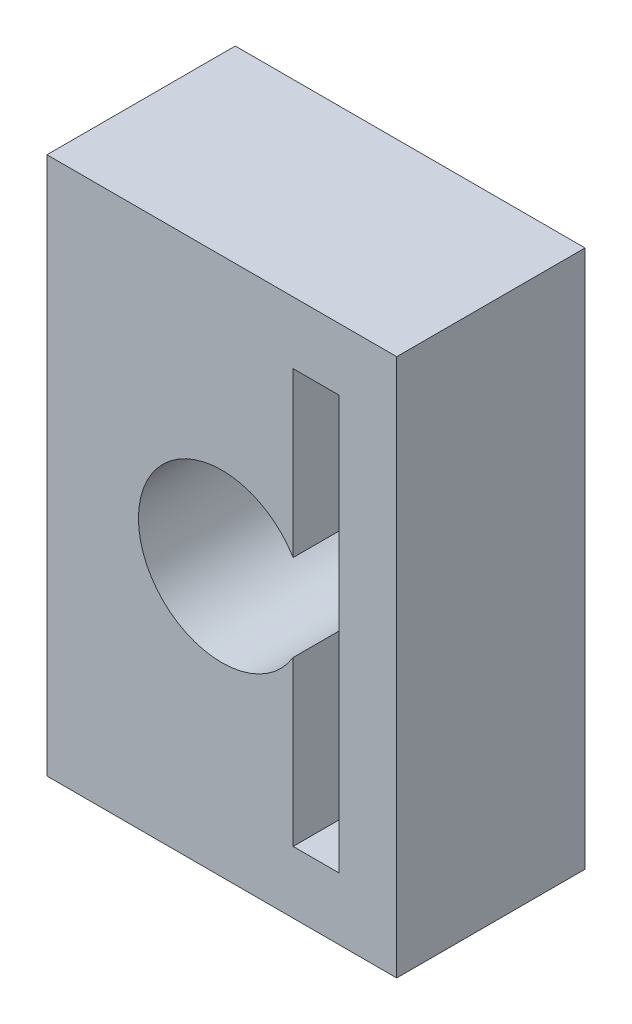
from build123d import *

# Parameters (mm, degrees)
SKETCH2_W           = 13
SKETCH2_H           = 20
BOSS_EXTRUDE1_DEPTH = 6
BOSS_EXTRUDE2_DEPTH = 2
BOSS_EXTRUDE3_START = 1
SKETCH3_W           = 13
SKETCH3_H           = 20
SKETCH3_R           = 3.2
BOSS_EXTRUDE3_DEPTH = 1
BOSS_EXTRUDE4_DEPTH = 4
CUT_EXTRUDE1_START  = -6
CUT_EXTRUDE1_DEPTH  = 6
BOSS_EXTRUDE5_DEPTH = 2
SKETCH8_R           = 3.2
SKETCH8_R_2         = 3.1
BOSS_EXTRUDE6_DEPTH = 7
SKETCH9_W           = 1.7
SKETCH9_H           = 15.38
CUT_EXTRUDE2_DEPTH  = 4


# Read off the part's stored shape, not the designer's step: Cut-Extrude1
with BuildPart() as part:
    # Sketch2 → Boss-Extrude1 (new body)
    with BuildSketch(Plane.XY):
        Rectangle(SKETCH2_W, SKETCH2_H)
        with BuildLine():
            Line((1.3, -9.04), (1.3, -2.924038303))
            ThreePointArc((1.3, -2.924038303), (-3.2, 0), (1.3, 2.924038303))
            Line((1.3, 2.924038303), (1.3, 9.04))
            Line((1.3, 9.04), (5.7, 9.04))
            Line((5.7, 9.04), (5.7, -9.04))
            Line((5.7, -9.04), (1.3, -9.04))
        make_face(mode=Mode.SUBTRACT)
    extrude(amount=BOSS_EXTRUDE1_DEPTH)

    # Sketch2<3> → Boss-Extrude2 (add)
    with BuildSketch(Plane.XY):
        with BuildLine():
            Line((4.2, 7.54), (4.2, -7.54))
            Line((4.2, -7.54), (2.8, -7.54))
            Line((2.8, -7.54), (2.8, -1.549193338))
            ThreePointArc((2.8, -1.549193338), (2.162186317, -2.359014695), (1.3, -2.924038303))
            Line((1.3, -2.924038303), (1.3, -9.04))
            Line((1.3, -9.04), (5.7, -9.04))
            Line((5.7, -9.04), (5.7, 9.04))
            Line((5.7, 9.04), (1.3, 9.04))
            Line((1.3, 9.04), (1.3, 2.924038303))
            ThreePointArc((1.3, 2.924038303), (2.162186317, 2.359014695), (2.8, 1.549193338))
            Line((2.8, 1.549193338), (2.8, 7.54))
            Line((2.8, 7.54), (4.2, 7.54))
        make_face()
    extrude(amount=BOSS_EXTRUDE2_DEPTH)

    # Sketch3 → Boss-Extrude3 (add)
    with BuildSketch(Plane(origin=(0, 0, 0), x_dir=(-1, 0, 0), z_dir=(0, 0, -1)).offset(BOSS_EXTRUDE3_START)):
        Rectangle(SKETCH3_W, SKETCH3_H)
        Circle(SKETCH3_R, mode=Mode.SUBTRACT)
    extrude(amount=-BOSS_EXTRUDE3_DEPTH)

    # Sketch4 → Boss-Extrude4 (add)
    with BuildSketch(Plane.XY.offset(2)):
        with BuildLine():
            Line((2.8, 1.549193338), (2.8, 7.54))
            Line((2.8, 7.54), (4.2, 7.54))
            Line((4.2, 7.54), (4.2, -7.54))
            Line((4.2, -7.54), (2.8, -7.54))
            Line((2.8, -7.54), (2.8, -1.549193338))
            ThreePointArc((2.8, -1.549193338), (2.162186317, -2.359014695), (1.3, -2.924038303))
            Line((1.3, -2.924038303), (1.3, -9.04))
            Line((1.3, -9.04), (5.7, -9.04))
            Line((5.7, -9.04), (5.7, 9.04))
            Line((5.7, 9.04), (1.3, 9.04))
            Line((1.3, 9.04), (1.3, 2.924038303))
            ThreePointArc((1.3, 2.924038303), (2.162186317, 2.359014695), (2.8, 1.549193338))
        make_face()
    extrude(amount=BOSS_EXTRUDE4_DEPTH)

    # Cut-Extrude1 outline → Cut-Extrude1 (cut)
    with BuildSketch(Plane.XY.offset(6).offset(CUT_EXTRUDE1_START)):
        with BuildLine():
            Line((4.35, 7.69), (2.65, 7.69))
            Line((2.65, 7.69), (2.65, 1.793739111))
            ThreePointArc((2.65, 1.793739111), (2.727741861, 1.673148033), (2.8, 1.549193338))
            Line((2.8, 1.549193338), (2.8, 7.54))
            Line((2.8, 7.54), (4.2, 7.54))
            Line((4.2, 7.54), (4.2, -7.54))
            Line((4.2, -7.54), (2.8, -7.54))
            Line((2.8, -7.54), (2.8, -1.549193338))
            ThreePointArc((2.8, -1.549193338), (2.727741861, -1.673148033), (2.65, -1.793739111))
            Line((2.65, -1.793739111), (2.65, -7.69))
            Line((2.65, -7.69), (4.35, -7.69))
            Line((4.35, -7.69), (4.35, 7.69))
        make_face()
    extrude(amount=CUT_EXTRUDE1_DEPTH, mode=Mode.SUBTRACT)

    # Sketch7 → Boss-Extrude5 (add)
    with BuildSketch(Plane.XY):
        with BuildLine():
            Line((2.65, 7.69), (2.65, 1.793739111))
            ThreePointArc((2.65, 1.793739111), (3.2, 0), (2.65, -1.793739111))
            Line((2.65, -1.793739111), (2.65, -7.69))
            Line((2.65, -7.69), (4.35, -7.69))
            Line((4.35, -7.69), (4.35, 7.69))
            Line((4.35, 7.69), (2.65, 7.69))
        make_face()
    extrude(amount=BOSS_EXTRUDE5_DEPTH)

    # Sketch8 → Boss-Extrude6 (add)
    with BuildSketch(Plane(origin=(0, 0, -1), x_dir=(-1, 0, 0), z_dir=(0, 0, -1))):
        Circle(SKETCH8_R)
        Circle(SKETCH8_R_2, mode=Mode.SUBTRACT)
    extrude(amount=-BOSS_EXTRUDE6_DEPTH)

    # Sketch9 → Cut-Extrude2 (cut)
    with BuildSketch(Plane.XY.offset(6)):
        with Locations((3.5, 0)):
            Rectangle(SKETCH9_W, SKETCH9_H)
    extrude(amount=-CUT_EXTRUDE2_DEPTH, mode=Mode.SUBTRACT)


solid = part.part
